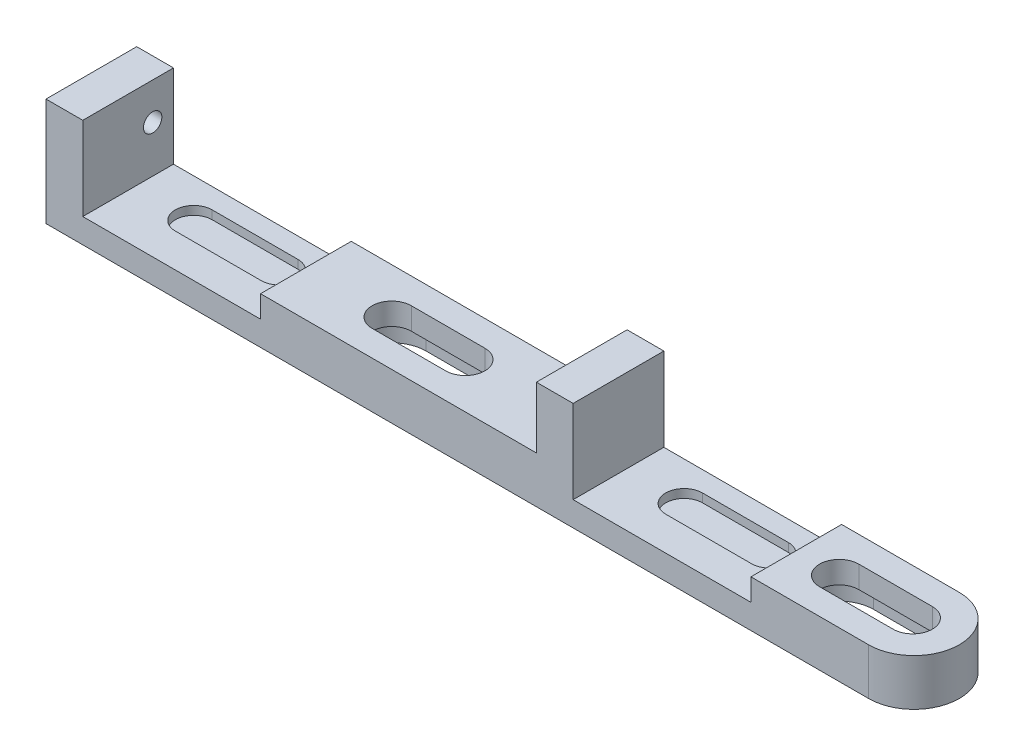
from build123d import *

# Parameters (mm, degrees)
BOSS_EXTRUDE1_DEPTH = 7.4
CUT_EXTRUDE1_DEPTH  = 10
CUT_EXTRUDE2_START  = -2
CUT_EXTRUDE2_DEPTH  = 2
CUT_EXTRUDE3_REACH  = 73.728
SKETCH5_R           = 0.75
CUT_EXTRUDE4_DEPTH  = 10
CUT_EXTRUDE5_DEPTH  = 0.7


with BuildPart() as part:
    # Sketch1 → Boss-Extrude1 (new body)
    with BuildSketch(Plane.XY):
        Polygon((0, 0), (0, 8.8), (3, 8.8), (3, 2), (17.5, 2), (17.5, 3.8), (40, 3.8), (40, 8.8), (43, 8.8), (43, 2), (57.5, 2), (57.5, 3.8), (70.8, 3.8), (70.8, 0), align=None)
    extrude(amount=BOSS_EXTRUDE1_DEPTH)

    # Sketch3 → Cut-Extrude1 (cut)
    with BuildSketch(Plane(origin=(0, 3.8, 0), x_dir=(1, 0, 0), z_dir=(0, 1, 0))):
        with BuildLine():
            Line((30.5, -5.3), (24.5, -5.3))
            ThreePointArc((24.5, -5.3), (22.9, -3.7), (24.5, -2.1))
            Line((24.5, -2.1), (30.5, -2.1))
            ThreePointArc((30.5, -2.1), (32.1, -3.7), (30.5, -5.3))
        make_face()
        with BuildLine():
            Line((67, -5.3), (61, -5.3))
            ThreePointArc((61, -5.3), (59.4, -3.7), (61, -2.1))
            Line((61, -2.1), (67, -2.1))
            ThreePointArc((67, -2.1), (68.6, -3.7), (67, -5.3))
        make_face()
    extrude(amount=-CUT_EXTRUDE1_DEPTH, mode=Mode.SUBTRACT)

    # Sketch4 → Cut-Extrude2 (cut)
    # profile 1 of 2: a face of its own
    with BuildSketch(Plane.XZ.offset(CUT_EXTRUDE2_START)):
        with BuildLine():
            Line((24.5, 6.5), (30.5, 6.5))
            ThreePointArc((30.5, 6.5), (33.3, 3.7), (30.5, 0.9))
            Line((30.5, 0.9), (24.5, 0.9))
            ThreePointArc((24.5, 0.9), (21.7, 3.7), (24.5, 6.5))
        make_face()
        with BuildLine():
            Line((24.5, 5.3), (30.5, 5.3))
            ThreePointArc((30.5, 5.3), (32.1, 3.7), (30.5, 2.1))
            Line((30.5, 2.1), (24.5, 2.1))
            ThreePointArc((24.5, 2.1), (22.9, 3.7), (24.5, 5.3))
        make_face(mode=Mode.SUBTRACT)
    # profile 2 of 2: a face of its own
    with BuildSketch(Plane.XZ.offset(CUT_EXTRUDE2_START)):
        with BuildLine():
            Line((61, 6.5), (67, 6.5))
            ThreePointArc((67, 6.5), (69.8, 3.7), (67, 0.9))
            Line((67, 0.9), (61, 0.9))
            ThreePointArc((61, 0.9), (58.2, 3.7), (61, 6.5))
        make_face()
        with BuildLine():
            Line((61, 5.3), (67, 5.3))
            ThreePointArc((67, 5.3), (68.6, 3.7), (67, 2.1))
            Line((67, 2.1), (61, 2.1))
            ThreePointArc((61, 2.1), (59.4, 3.7), (61, 5.3))
        make_face(mode=Mode.SUBTRACT)
    extrude(amount=CUT_EXTRUDE2_DEPTH, mode=Mode.SUBTRACT)

    # Sketch5 → Cut-Extrude3 (cut, up to next)
    with BuildSketch(Plane.ZY, mode=Mode.PRIVATE) as cut_extrude3_sk1:
        with Locations((1.7, 5.8)):
            Circle(SKETCH5_R)
    cut_extrude3_tool1 = extrude(cut_extrude3_sk1.sketch, amount=-CUT_EXTRUDE3_REACH, mode=Mode.PRIVATE) & part.part
    add(cut_extrude3_tool1.solids().sort_by_distance((0, 5.8, 1.7))[0], mode=Mode.SUBTRACT)

    # Sketch6 → Cut-Extrude4 (cut)
    with BuildSketch(Plane.XZ):
        with BuildLine():
            Line((67.1, 0), (70.8, 0))
            Line((70.8, 0), (70.8, 3.7))
            ThreePointArc((70.8, 3.7), (69.71629509, 1.08370491), (67.1, 0))
        make_face()
        with BuildLine():
            ThreePointArc((67.1, 7.4), (69.71629509, 6.31629509), (70.8, 3.7))
            Line((70.8, 3.7), (70.8, 7.4))
            Line((70.8, 7.4), (67.1, 7.4))
        make_face()
    extrude(amount=-CUT_EXTRUDE4_DEPTH, mode=Mode.SUBTRACT)

    # Sketch7 → Cut-Extrude5 (cut)
    with BuildSketch(Plane(origin=(0, 2, 0), x_dir=(1, 0, 0), z_dir=(0, 1, 0))):
        with BuildLine():
            Line((54.8, -4.65), (47.8, -4.65))
            ThreePointArc((47.8, -4.65), (46.3, -3.15), (47.8, -1.65))
            Line((47.8, -1.65), (54.8, -1.65))
            ThreePointArc((54.8, -1.65), (56.3, -3.15), (54.8, -4.65))
        make_face()
        with BuildLine():
            Line((14.8, -4.65), (7.8, -4.65))
            ThreePointArc((7.8, -4.65), (6.3, -3.15), (7.8, -1.65))
            Line((7.8, -1.65), (14.8, -1.65))
            ThreePointArc((14.8, -1.65), (16.3, -3.15), (14.8, -4.65))
        make_face()
    extrude(amount=-CUT_EXTRUDE5_DEPTH, mode=Mode.SUBTRACT)


solid = part.part
